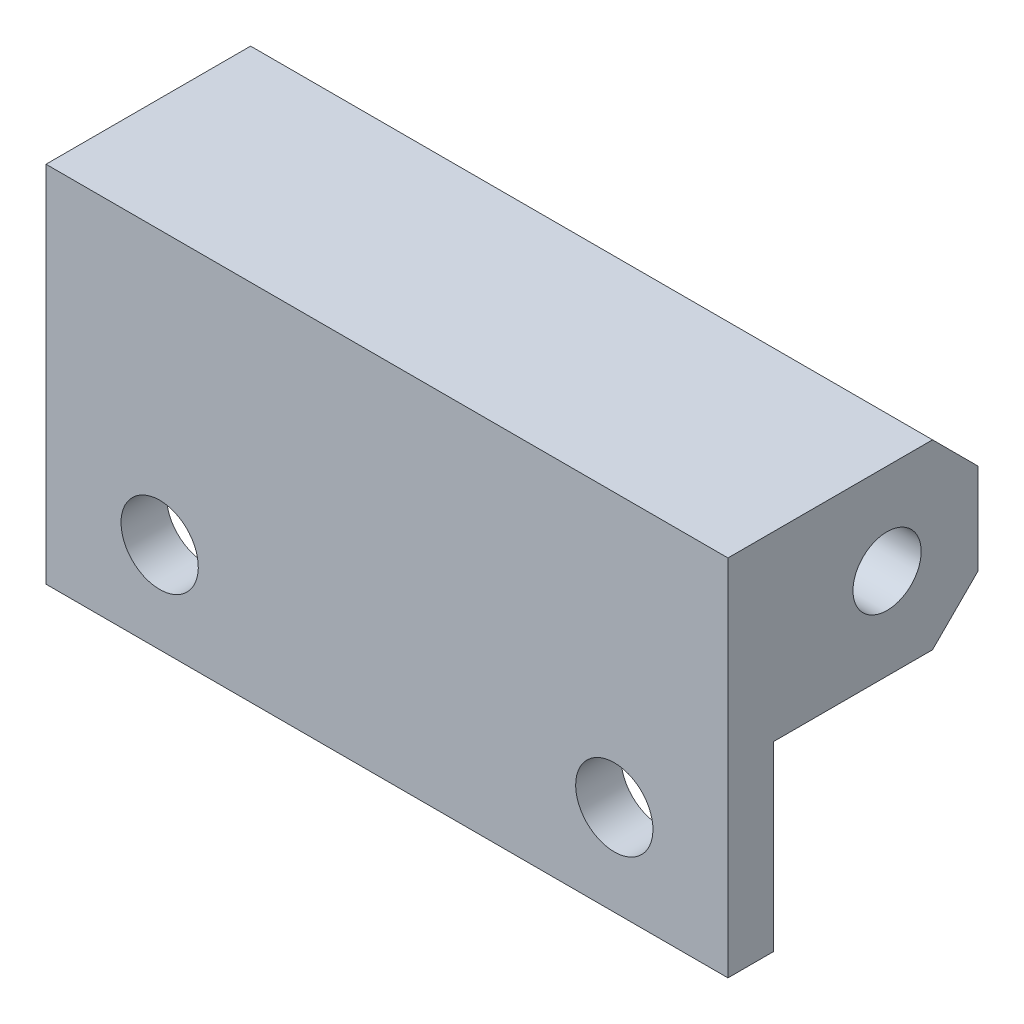
from build123d import *

# Parameters (mm, degrees)
BOSS_EXTRUDE1_DEPTH     = 15
M3_CLEARANCE_HOLE1_D    = 3.4
CUT_EXTRUDE1_DEPTH      = 34.06055051
CUT_EXTRUDE1_DEPTH_BACK = 34.06055051
SKETCH4_R               = 1.5


with BuildPart() as part:
    # Sketch1 → Boss-Extrude1 (new, symmetric)
    with BuildSketch(Plane(origin=(0, 0, 0), x_dir=(0, 0, -1), z_dir=(1, 0, 0))):
        Polygon((-7, 4), (2, 4), (4, 2), (4, -2), (2, -4), (-5, -4), (-5, -12), (-7, -12), align=None)
    extrude(amount=BOSS_EXTRUDE1_DEPTH, both=True)

    # M3 Clearance Hole1 (through all)
    with Locations(Plane(origin=(0, 0, 5), x_dir=(-1, 0, 0), z_dir=(0, 0, -1))):
        with Locations((-10, -8), (10, -8)):
            Hole(M3_CLEARANCE_HOLE1_D / 2)

    # Sketch4 → Cut-Extrude1 (cut, two sides: drawn at the far end of the back side and taken through both)
    with BuildSketch(Plane(origin=(15, 0, 0), x_dir=(0, 0, -1), z_dir=(1, 0, 0)).offset(-CUT_EXTRUDE1_DEPTH_BACK)):
        Circle(SKETCH4_R)
    extrude(amount=CUT_EXTRUDE1_DEPTH + CUT_EXTRUDE1_DEPTH_BACK, mode=Mode.SUBTRACT)


solid = part.part
